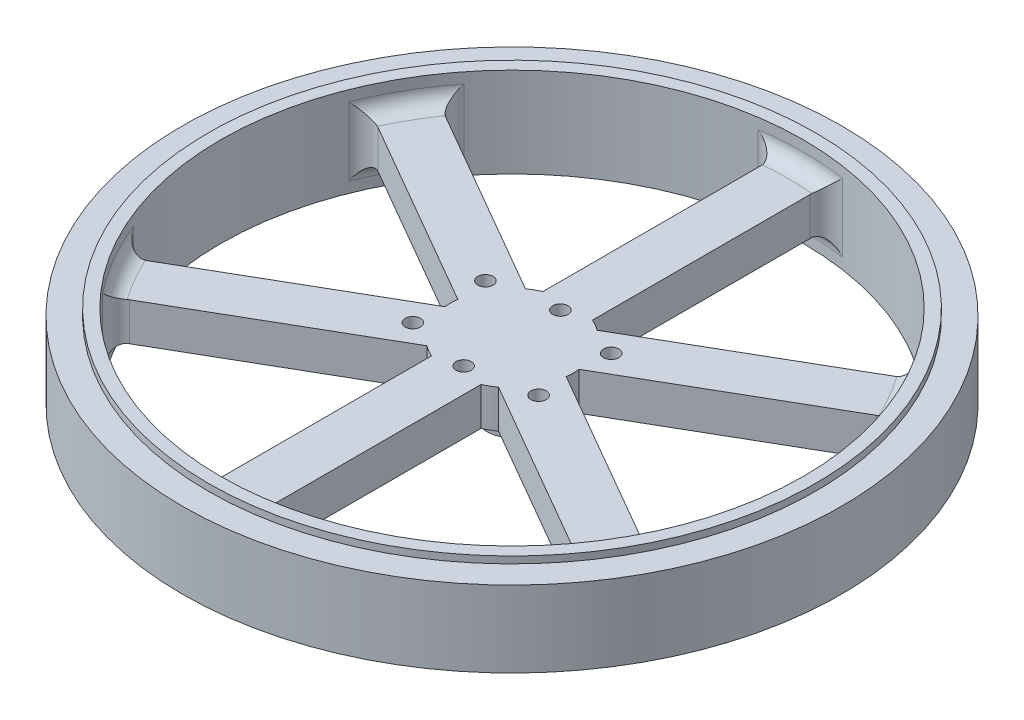
from build123d import *

# Parameters (mm, degrees)
SKETCH1_R                = 43.25
BOSS_EXTRUDE1_DEPTH      = 10
SKETCH3_R                = 39.85
SKETCH3_R_2              = 38.25
BOSS_EXTRUDE2_DEPTH      = 0.9
SKETCH4_R                = 38.25
CUT_EXTRUDE1_DEPTH       = 63.12837516
BOSS_EXTRUDE3_DEPTH      = 2.5
BOSS_EXTRUDE3_DEPTH_BACK = 2.5
SKETCH5_R                = 8
SKETCH6_R                = 3.3
BOSS_EXTRUDE4_DEPTH      = 4
SKETCH7_R                = 1
CUT_EXTRUDE2_DEPTH       = 62.738845146
FILLET1_R                = 2


with BuildPart() as part:
    # Sketch1 → Boss-Extrude1 (new body)
    with BuildSketch(Plane(origin=(0, 0, 0), x_dir=(1, 0, 0), z_dir=(0, 1, 0))):
        with Locations(Location((0, 0, 0), (0, 0, 270))):
            Circle(SKETCH1_R)
    extrude(amount=BOSS_EXTRUDE1_DEPTH)

    # Sketch3 → Boss-Extrude2 (add)
    with BuildSketch(Plane(origin=(0, 10, 0), x_dir=(1, 0, 0), z_dir=(0, 1, 0))):
        with Locations(Location((0, 0, 0), (0, 0, 270))):
            Circle(SKETCH3_R)
        with Locations(Location((0, 0, 0), (0, 0, 270))):
            Circle(SKETCH3_R_2, mode=Mode.SUBTRACT)
    boss_extrude2 = extrude(amount=BOSS_EXTRUDE2_DEPTH)

    # Mirror1: Boss-Extrude2 across plane
    add(boss_extrude2.mirror(Plane.ZX.offset(5)))

    # Sketch4 → Cut-Extrude1 (cut, through all)
    with BuildSketch(Plane(origin=(0, 10, 0), x_dir=(1, 0, 0), z_dir=(0, 1, 0))):
        with Locations(Location((0, 0, 0), (0, 0, 270))):
            Circle(SKETCH4_R)
    extrude(amount=-CUT_EXTRUDE1_DEPTH, mode=Mode.SUBTRACT)

    # Sketch5 → Boss-Extrude3 (add, two sides: drawn at the far end of the back side and taken through both)
    with BuildSketch(Plane(origin=(0, 5, 0), x_dir=(1, 0, 0), z_dir=(0, 1, 0)).offset(-BOSS_EXTRUDE3_DEPTH_BACK)):
        with BuildLine():
            ThreePointArc((-7.955728631, 0.840465317), (-6.92820323, 4), (-4.705728631, 6.469630442))
            Line((-4.705728631, 6.469630442), (-31.380681329, 21.870421562))
            ThreePointArc((-31.380681329, 21.870421562), (-33.125471695, 19.125), (-34.630681329, 16.241256438))
            Line((-34.630681329, 16.241256438), (-7.955728631, 0.840465317))
        make_face()
        with BuildLine():
            Line((0, 38.25), (0, 8))
            ThreePointArc((0, 8), (1.661209489, 7.825623492), (3.25, 7.310095759))
            Line((3.25, 7.310095759), (3.25, 38.111678))
            ThreePointArc((3.25, 38.111678), (1.626471101, 38.215403854), (0, 38.25))
        make_face()
        with BuildLine():
            ThreePointArc((-3.25, 7.310095759), (-1.661209489, 7.825623492), (0, 8))
            Line((0, 8), (0, 38.25))
            ThreePointArc((0, 38.25), (-1.626471101, 38.215403854), (-3.25, 38.111678))
            Line((-3.25, 38.111678), (-3.25, 7.310095759))
        make_face()
        with BuildLine():
            Line((31.380681329, 21.870421562), (4.705728631, 6.469630442))
            ThreePointArc((4.705728631, 6.469630442), (6.92820323, 4), (7.955728631, 0.840465317))
            Line((7.955728631, 0.840465317), (34.630681329, 16.241256438))
            ThreePointArc((34.630681329, 16.241256438), (33.125471695, 19.125), (31.380681329, 21.870421562))
        make_face()
        with BuildLine():
            Line((34.630681329, -16.241256438), (7.955728631, -0.840465317))
            ThreePointArc((7.955728631, -0.840465317), (6.92820323, -4), (4.705728631, -6.469630442))
            Line((4.705728631, -6.469630442), (31.380681329, -21.870421562))
            ThreePointArc((31.380681329, -21.870421562), (33.125471695, -19.125), (34.630681329, -16.241256438))
        make_face()
        with BuildLine():
            ThreePointArc((3.25, -7.310095759), (0, -8), (-3.25, -7.310095759))
            Line((-3.25, -7.310095759), (-3.25, -38.111678))
            ThreePointArc((-3.25, -38.111678), (0, -38.25), (3.25, -38.111678))
            Line((3.25, -38.111678), (3.25, -7.310095759))
        make_face()
        with BuildLine():
            ThreePointArc((-4.705728631, -6.469630442), (-6.92820323, -4), (-7.955728631, -0.840465317))
            Line((-7.955728631, -0.840465317), (-34.630681329, -16.241256438))
            ThreePointArc((-34.630681329, -16.241256438), (-33.125471695, -19.125), (-31.380681329, -21.870421562))
            Line((-31.380681329, -21.870421562), (-4.705728631, -6.469630442))
        make_face()
        Circle(SKETCH5_R)
    extrude(amount=BOSS_EXTRUDE3_DEPTH + BOSS_EXTRUDE3_DEPTH_BACK)

    # Sketch6 → Boss-Extrude4 (add)
    with BuildSketch(Plane(origin=(0, 2.5, 0), x_dir=(-1, 0, 0), z_dir=(0, -1, 0))):
        with Locations(Location((0, 0, 0), (0, 0, 270))):
            Circle(SKETCH6_R)
    extrude(amount=BOSS_EXTRUDE4_DEPTH)

    # Sketch7 → Cut-Extrude2 (cut, through all)
    with BuildSketch(Plane(origin=(0, 2.5, 0), x_dir=(-1, 0, 0), z_dir=(0, -1, 0))):
        with Locations(Location((0, -6.35, 0), (0, 0, 90))):
            Circle(SKETCH7_R)
        with Locations(Location((0, 6.35, 0), (0, 0, 270))):
            Circle(SKETCH7_R)
        with Locations(Location((-8.249757996, -4.763, 0), (0, 0, 90))):
            Circle(SKETCH7_R)
        with Locations(Location((-8.249757996, 4.763, 0), (0, 0, 90))):
            Circle(SKETCH7_R)
        with Locations(Location((8.249757996, 4.763, 0), (0, 0, 90))):
            Circle(SKETCH7_R)
        with Locations(Location((8.249757996, -4.763, 0), (0, 0, 90))):
            Circle(SKETCH7_R)
    extrude(amount=-CUT_EXTRUDE2_DEPTH, mode=Mode.SUBTRACT)

    # Fillet1
    # the kernel refuses this fillet: 2 mm, written as the material it adds along each edge
    with BuildSketch(Plane(origin=(-3.25, 2.5, -38.111678), x_dir=(-0.9933713202979351, 0, 0.1149496411892501), z_dir=(0, 1, 0)), Plane(origin=(31.380681329, 2.5, -21.870421562), x_dir=(-0.5962349695747641, 0, -0.8028099781742754), z_dir=(0, 1, 0)), Plane(origin=(31.380681329, 7.5, 21.870421562), x_dir=(-0.5962349695747706, 0, 0.8028099781742702), z_dir=(0, -1, 0)), Plane(origin=(3.25, 2.5, 38.111678), x_dir=(0.9933713202979246, 0, -0.11494964118934071), z_dir=(0, 1, 0)), Plane(origin=(-31.380681329, 2.5, 21.870421562), x_dir=(0.5962349695747768, 0, 0.8028099781742658), z_dir=(0, 1, 0)), Plane(origin=(-34.630681329, 2.5, -16.241256438), x_dir=(-0.39713635072318026, 0, 0.9177596193635211), z_dir=(0, 1, 0))) as fillet1_piece_1:
        with BuildLine():
            CenterArc((2.244674132, 1.999091986), FILLET1_R, 173.399279561, 98.327295218)
            Line((0.257931492, 2.228991268), (0, 0))
            ThreePointArc((0, 0), (1.15246692, -0.017365772), (2.304933841, 0))
        make_face()
    fillet1_piece_1_solid = extrude(amount=5, mode=Mode.PRIVATE)
    with BuildSketch(Plane(origin=(0, 2.5, 0), x_dir=(0.21411864564449046, 0, -0.9768076604876565), z_dir=(0.9768076604876565, 0, 0.21411864564449046))) as fillet1_piece_2_section:
        with BuildLine():
            CenterArc((38.25 - FILLET1_R, -FILLET1_R), FILLET1_R, 0, 90)
            Line((38.25 - FILLET1_R, 0), (38.25, 0))
            Line((38.25, 0), (38.25, -FILLET1_R))
        make_face()
    fillet1_piece_2 = revolve(axis=Axis((0, 2.5, 0), (0, 1, 0)), revolution_arc=24.727650657, mode=Mode.PRIVATE)
    fillet1_piece_2 = split(fillet1_piece_2, bisect_by=Plane(origin=(3.25, 2.5, 0), z_dir=(-1, 0, 0)), keep=Keep.TOP, mode=Mode.PRIVATE)
    fillet1_piece_2 = split(fillet1_piece_2, bisect_by=Plane(origin=(-3.25, 2.5, 0), z_dir=(1, 0, 0)), keep=Keep.TOP, mode=Mode.PRIVATE)
    with BuildSketch(Plane(origin=(3.25, 2.5, -38.111678), x_dir=(0.9933713202979347, 0, 0.11494964118925292), z_dir=(0, 1, 0)), Plane(origin=(34.630681329, 2.5, -16.241256438), x_dir=(0.39713635072316383, 0, 0.9177596193635281), z_dir=(0, 1, 0)), Plane(origin=(34.630681329, 7.5, 16.241256438), x_dir=(0.39713635072317044, 0, -0.9177596193635253), z_dir=(0, -1, 0)), Plane(origin=(-3.25, 2.5, 38.111678), x_dir=(-0.9933713202979313, 0, -0.11494964118928287), z_dir=(0, 1, 0)), Plane(origin=(-34.630681329, 2.5, 16.241256438), x_dir=(-0.3971363507232063, 0, -0.9177596193635098), z_dir=(0, 1, 0)), Plane(origin=(-31.380681329, 2.5, -21.870421562), x_dir=(0.5962349695747751, 0, -0.802809978174267), z_dir=(0, 1, 0))) as fillet1_piece_3:
        with BuildLine():
            CenterArc((2.244674132, -1.999091986), FILLET1_R, 88.273425221, 98.327295218)
            Line((0.257931492, -2.228991268), (0, 0))
            ThreePointArc((0, 0), (1.15246692, 0.017365772), (2.304933841, 0))
        make_face()
    fillet1_piece_3_solid = extrude(amount=5, mode=Mode.PRIVATE)
    with BuildSketch(Plane(origin=(0, 2.5, 0), x_dir=(0.9529995714158058, 0, -0.3029716436917663), z_dir=(0.3029716436917663, 0, 0.9529995714158058))) as fillet1_piece_4_section:
        with BuildLine():
            CenterArc((38.25 - FILLET1_R, -FILLET1_R), FILLET1_R, 0, 90)
            Line((38.25 - FILLET1_R, 0), (38.25, 0))
            Line((38.25, 0), (38.25, -FILLET1_R))
        make_face()
    fillet1_piece_4 = revolve(axis=Axis((0, 2.5, 0), (0, 1, 0)), revolution_arc=24.727650657, mode=Mode.PRIVATE)
    fillet1_piece_4 = split(fillet1_piece_4, bisect_by=Plane(origin=(1.625, 2.5, 2.814582562), z_dir=(-0.49999999999999806, 0, -0.8660254037844398)), keep=Keep.TOP, mode=Mode.PRIVATE)
    fillet1_piece_4 = split(fillet1_piece_4, bisect_by=Plane(origin=(-1.625, 2.5, -2.814582562), z_dir=(0.49999999999999806, 0, 0.8660254037844398)), keep=Keep.TOP, mode=Mode.PRIVATE)
    with BuildSketch(Plane(origin=(0, 2.5, 0), x_dir=(0.738880925771294, 0, 0.6738360167958934), z_dir=(-0.6738360167958934, 0, 0.738880925771294))) as fillet1_piece_5_section:
        with BuildLine():
            CenterArc((38.25 - FILLET1_R, -FILLET1_R), FILLET1_R, 0, 90)
            Line((38.25 - FILLET1_R, 0), (38.25, 0))
            Line((38.25, 0), (38.25, -FILLET1_R))
        make_face()
    fillet1_piece_5 = revolve(axis=Axis((0, 2.5, 0), (0, 1, 0)), revolution_arc=24.727650657, mode=Mode.PRIVATE)
    fillet1_piece_5 = split(fillet1_piece_5, bisect_by=Plane(origin=(1.625, 2.5, -2.814582562), z_dir=(-0.500000000000004, 0, 0.8660254037844364)), keep=Keep.TOP, mode=Mode.PRIVATE)
    fillet1_piece_5 = split(fillet1_piece_5, bisect_by=Plane(origin=(-1.625, 2.5, 2.814582562), z_dir=(0.500000000000004, 0, -0.8660254037844364)), keep=Keep.TOP, mode=Mode.PRIVATE)
    with BuildSketch(Plane(origin=(0, 2.5, 0), x_dir=(-0.2141181944422645, 0, 0.976807759392187), z_dir=(-0.976807759392187, 0, -0.2141181944422645))) as fillet1_piece_6_section:
        with BuildLine():
            CenterArc((38.25 - FILLET1_R, -FILLET1_R), FILLET1_R, 0, 90)
            Line((38.25 - FILLET1_R, 0), (38.25, 0))
            Line((38.25, 0), (38.25, -FILLET1_R))
        make_face()
    fillet1_piece_6 = revolve(axis=Axis((0, 2.5, 0), (0, 1, 0)), revolution_arc=12.363798863, mode=Mode.PRIVATE)
    fillet1_piece_6 = split(fillet1_piece_6, bisect_by=Plane(origin=(-3.25, 2.5, 0), z_dir=(1, 0, 0)), keep=Keep.TOP, mode=Mode.PRIVATE)
    with BuildSketch(Plane(origin=(0, 2.5, 0), x_dir=(-0.952999571415801, 0, 0.30297164369178087), z_dir=(-0.30297164369178087, 0, -0.952999571415801))) as fillet1_piece_7_section:
        with BuildLine():
            CenterArc((38.25 - FILLET1_R, -FILLET1_R), FILLET1_R, 0, 90)
            Line((38.25 - FILLET1_R, 0), (38.25, 0))
            Line((38.25, 0), (38.25, -FILLET1_R))
        make_face()
    fillet1_piece_7 = revolve(axis=Axis((0, 2.5, 0), (0, 1, 0)), revolution_arc=24.727650657, mode=Mode.PRIVATE)
    fillet1_piece_7 = split(fillet1_piece_7, bisect_by=Plane(origin=(1.625, 2.5, 2.814582562), z_dir=(-0.500000000000019, 0, -0.8660254037844277)), keep=Keep.TOP, mode=Mode.PRIVATE)
    fillet1_piece_7 = split(fillet1_piece_7, bisect_by=Plane(origin=(-1.625, 2.5, -2.814582562), z_dir=(0.5000000000000189, 0, 0.8660254037844278)), keep=Keep.TOP, mode=Mode.PRIVATE)
    with BuildSketch(Plane(origin=(0, 2.5, 0), x_dir=(-0.7388809257712972, 0, -0.6738360167958901), z_dir=(0.6738360167958901, 0, -0.7388809257712972))) as fillet1_piece_8_section:
        with BuildLine():
            CenterArc((38.25 - FILLET1_R, -FILLET1_R), FILLET1_R, 0, 90)
            Line((38.25 - FILLET1_R, 0), (38.25, 0))
            Line((38.25, 0), (38.25, -FILLET1_R))
        make_face()
    fillet1_piece_8 = revolve(axis=Axis((0, 2.5, 0), (0, 1, 0)), revolution_arc=24.727650657, mode=Mode.PRIVATE)
    fillet1_piece_8 = split(fillet1_piece_8, bisect_by=Plane(origin=(1.625, 2.5, -2.814582562), z_dir=(-0.5000000000000101, 0, 0.8660254037844328)), keep=Keep.TOP, mode=Mode.PRIVATE)
    fillet1_piece_8 = split(fillet1_piece_8, bisect_by=Plane(origin=(-1.625, 2.5, 2.814582562), z_dir=(0.5000000000000099, 0, -0.8660254037844329)), keep=Keep.TOP, mode=Mode.PRIVATE)
    with BuildSketch(Plane(origin=(0, 7.5, 0), x_dir=(-0.21411864564449054, 0, -0.9768076604876568), z_dir=(-0.9768076604876568, 0, 0.21411864564449054))) as fillet1_piece_9_section:
        with BuildLine():
            CenterArc((38.25 - FILLET1_R, -FILLET1_R), FILLET1_R, 0, 90)
            Line((38.25 - FILLET1_R, 0), (38.25, 0))
            Line((38.25, 0), (38.25, -FILLET1_R))
        make_face()
    fillet1_piece_9 = revolve(axis=Axis((0, 7.5, 0), (0, -1, 0)), revolution_arc=24.727650657, mode=Mode.PRIVATE)
    fillet1_piece_9 = split(fillet1_piece_9, bisect_by=Plane(origin=(3.25, 7.5, 0), z_dir=(-1, 0, 0)), keep=Keep.TOP, mode=Mode.PRIVATE)
    fillet1_piece_9 = split(fillet1_piece_9, bisect_by=Plane(origin=(-3.25, 7.5, 0), z_dir=(1, 0, 0)), keep=Keep.TOP, mode=Mode.PRIVATE)
    with BuildSketch(Plane(origin=(0, 7.5, 0), x_dir=(-0.7388809257712972, 0, -0.6738360167958901), z_dir=(0.6738360167958901, 0, -0.7388809257712972))) as fillet1_piece_10_section:
        with BuildLine():
            CenterArc((38.25 - FILLET1_R, FILLET1_R), FILLET1_R, 270, 90)
            Line((38.25 - FILLET1_R, 0), (38.25, 0))
            Line((38.25, 0), (38.25, FILLET1_R))
        make_face()
    fillet1_piece_10 = revolve(axis=Axis((0, 7.5, 0), (0, 1, 0)), revolution_arc=24.727650657, mode=Mode.PRIVATE)
    fillet1_piece_10 = split(fillet1_piece_10, bisect_by=Plane(origin=(1.625, 7.5, -2.814582562), z_dir=(-0.5000000000000101, 0, 0.8660254037844328)), keep=Keep.TOP, mode=Mode.PRIVATE)
    fillet1_piece_10 = split(fillet1_piece_10, bisect_by=Plane(origin=(-1.625, 7.5, 2.814582562), z_dir=(0.5000000000000099, 0, -0.8660254037844329)), keep=Keep.TOP, mode=Mode.PRIVATE)
    with BuildSketch(Plane(origin=(0, 7.5, 0), x_dir=(-0.952999571415801, 0, 0.30297164369178087), z_dir=(-0.30297164369178087, 0, -0.952999571415801))) as fillet1_piece_11_section:
        with BuildLine():
            CenterArc((38.25 - FILLET1_R, FILLET1_R), FILLET1_R, 270, 90)
            Line((38.25 - FILLET1_R, 0), (38.25, 0))
            Line((38.25, 0), (38.25, FILLET1_R))
        make_face()
    fillet1_piece_11 = revolve(axis=Axis((0, 7.5, 0), (0, 1, 0)), revolution_arc=24.727650657, mode=Mode.PRIVATE)
    fillet1_piece_11 = split(fillet1_piece_11, bisect_by=Plane(origin=(1.625, 7.5, 2.814582562), z_dir=(-0.500000000000019, 0, -0.8660254037844277)), keep=Keep.TOP, mode=Mode.PRIVATE)
    fillet1_piece_11 = split(fillet1_piece_11, bisect_by=Plane(origin=(-1.625, 7.5, -2.814582562), z_dir=(0.5000000000000189, 0, 0.8660254037844278)), keep=Keep.TOP, mode=Mode.PRIVATE)
    with BuildSketch(Plane(origin=(0, 7.5, 0), x_dir=(-0.2141181944422645, 0, 0.976807759392187), z_dir=(-0.976807759392187, 0, -0.2141181944422645))) as fillet1_piece_12_section:
        with BuildLine():
            CenterArc((38.25 - FILLET1_R, FILLET1_R), FILLET1_R, 270, 90)
            Line((38.25 - FILLET1_R, 0), (38.25, 0))
            Line((38.25, 0), (38.25, FILLET1_R))
        make_face()
    fillet1_piece_12 = revolve(axis=Axis((0, 7.5, 0), (0, 1, 0)), revolution_arc=12.363798863, mode=Mode.PRIVATE)
    fillet1_piece_12 = split(fillet1_piece_12, bisect_by=Plane(origin=(-3.25, 7.5, 0), z_dir=(1, 0, 0)), keep=Keep.TOP, mode=Mode.PRIVATE)
    with BuildSketch(Plane(origin=(0, 7.5, 0), x_dir=(0.738880925771294, 0, 0.6738360167958934), z_dir=(-0.6738360167958934, 0, 0.738880925771294))) as fillet1_piece_13_section:
        with BuildLine():
            CenterArc((38.25 - FILLET1_R, FILLET1_R), FILLET1_R, 270, 90)
            Line((38.25 - FILLET1_R, 0), (38.25, 0))
            Line((38.25, 0), (38.25, FILLET1_R))
        make_face()
    fillet1_piece_13 = revolve(axis=Axis((0, 7.5, 0), (0, 1, 0)), revolution_arc=24.727650657, mode=Mode.PRIVATE)
    fillet1_piece_13 = split(fillet1_piece_13, bisect_by=Plane(origin=(1.625, 7.5, -2.814582562), z_dir=(-0.500000000000004, 0, 0.8660254037844364)), keep=Keep.TOP, mode=Mode.PRIVATE)
    fillet1_piece_13 = split(fillet1_piece_13, bisect_by=Plane(origin=(-1.625, 7.5, 2.814582562), z_dir=(0.500000000000004, 0, -0.8660254037844364)), keep=Keep.TOP, mode=Mode.PRIVATE)
    with BuildSketch(Plane(origin=(0, 7.5, 0), x_dir=(0.9529995714158058, 0, -0.3029716436917663), z_dir=(0.3029716436917663, 0, 0.9529995714158058))) as fillet1_piece_14_section:
        with BuildLine():
            CenterArc((38.25 - FILLET1_R, FILLET1_R), FILLET1_R, 270, 90)
            Line((38.25 - FILLET1_R, 0), (38.25, 0))
            Line((38.25, 0), (38.25, FILLET1_R))
        make_face()
    fillet1_piece_14 = revolve(axis=Axis((0, 7.5, 0), (0, 1, 0)), revolution_arc=24.727650657, mode=Mode.PRIVATE)
    fillet1_piece_14 = split(fillet1_piece_14, bisect_by=Plane(origin=(1.625, 7.5, 2.814582562), z_dir=(-0.49999999999999806, 0, -0.8660254037844398)), keep=Keep.TOP, mode=Mode.PRIVATE)
    fillet1_piece_14 = split(fillet1_piece_14, bisect_by=Plane(origin=(-1.625, 7.5, -2.814582562), z_dir=(0.49999999999999806, 0, 0.8660254037844398)), keep=Keep.TOP, mode=Mode.PRIVATE)
    with BuildSketch(Plane(origin=(0, 7.5, 0), x_dir=(0, 0, 1), z_dir=(-1, 0, 0))) as fillet1_piece_15_section:
        with BuildLine():
            CenterArc((38.25 - FILLET1_R, FILLET1_R), FILLET1_R, 270, 90)
            Line((38.25 - FILLET1_R, 0), (38.25, 0))
            Line((38.25, 0), (38.25, FILLET1_R))
        make_face()
    fillet1_piece_15 = revolve(axis=Axis((0, 7.5, 0), (0, 1, 0)), revolution_arc=12.363798863, mode=Mode.PRIVATE)
    fillet1_piece_15 = split(fillet1_piece_15, bisect_by=Plane(origin=(3.25, 7.5, 0), z_dir=(-1, 0, 0)), keep=Keep.TOP, mode=Mode.PRIVATE)
    with BuildSketch(Plane(origin=(0, 2.5, 0), x_dir=(0, 0, 1), z_dir=(-1, 0, 0))) as fillet1_piece_16_section:
        with BuildLine():
            CenterArc((38.25 - FILLET1_R, -FILLET1_R), FILLET1_R, 0, 90)
            Line((38.25 - FILLET1_R, 0), (38.25, 0))
            Line((38.25, 0), (38.25, -FILLET1_R))
        make_face()
    fillet1_piece_16 = revolve(axis=Axis((0, 2.5, 0), (0, 1, 0)), revolution_arc=12.363798863, mode=Mode.PRIVATE)
    fillet1_piece_16 = split(fillet1_piece_16, bisect_by=Plane(origin=(3.25, 2.5, 0), z_dir=(-1, 0, 0)), keep=Keep.TOP, mode=Mode.PRIVATE)
    with BuildSketch(Plane(origin=(0, 2.5, 0), x_dir=(0.21411864564449046, 0, -0.9768076604876565), z_dir=(0.9768076604876565, 0, 0.21411864564449046))) as fillet1_piece_17a_section:
        with BuildLine():
            CenterArc((38.25 - FILLET1_R, -FILLET1_R), FILLET1_R, 0, 90)
            Line((38.25 - FILLET1_R, 0), (38.25, 0))
            Line((38.25, 0), (38.25, -FILLET1_R))
        make_face()
    fillet1_piece_17a = revolve(axis=Axis((0, 2.5, 0), (0, 1, 0)), revolution_arc=24.727650657, mode=Mode.PRIVATE)
    fillet1_piece_17a = split(fillet1_piece_17a, bisect_by=Plane(origin=(-3.25, 2.5, 0), z_dir=(-1, 0, 0)), keep=Keep.TOP, mode=Mode.PRIVATE)
    with BuildSketch(Plane(origin=(-3.25, -3.262334601, -38.111678), x_dir=(-0.9933713202979351, 0, 0.1149496411892501), z_dir=(0, 1, 0))) as fillet1_piece_17b_section:
        with BuildLine():
            CenterArc((2.244674132, 1.999091986), FILLET1_R, 173.399279561, 98.327295218)
            Line((0.257931492, 2.228991268), (0, 0))
            ThreePointArc((0, 0), (1.15246692, -0.017365772), (2.304933841, 0))
        make_face()
    fillet1_piece_17b = extrude(amount=10.762334601, mode=Mode.PRIVATE)
    fillet1_piece_17b = split(fillet1_piece_17b, bisect_by=Plane(origin=(-3.25, -0.9, -38.111678), z_dir=(0, 1, 0)), keep=Keep.TOP, mode=Mode.PRIVATE)
    fillet1_piece_17b = split(fillet1_piece_17b, bisect_by=Plane(origin=(-3.25, 2.5, -38.111678), z_dir=(0, -1, 0)), keep=Keep.TOP, mode=Mode.PRIVATE)
    fillet1_piece_17 = fillet1_piece_17a & fillet1_piece_17b
    with BuildSketch(Plane(origin=(-3.25, 2.5, -38.111678), x_dir=(-0.9933713202979351, 0, 0.1149496411892501), z_dir=(0, 1, 0))) as fillet1_piece_18a_section:
        with BuildLine():
            CenterArc((2.244674132, 1.999091986), FILLET1_R, 173.399279561, 98.327295218)
            Line((0.257931492, 2.228991268), (0, 0))
            ThreePointArc((0, 0), (1.15246692, -0.017365772), (2.304933841, 0))
        make_face()
    fillet1_piece_18a = extrude(amount=10.762334601, mode=Mode.PRIVATE)
    fillet1_piece_18a = split(fillet1_piece_18a, bisect_by=Plane(origin=(-3.25, 10.9, -38.111678), z_dir=(0, -1, 0)), keep=Keep.TOP, mode=Mode.PRIVATE)
    fillet1_piece_18a = split(fillet1_piece_18a, bisect_by=Plane(origin=(-3.25, 7.5, -38.111678), z_dir=(0, 1, 0)), keep=Keep.TOP, mode=Mode.PRIVATE)
    with BuildSketch(Plane(origin=(0, 7.5, 0), x_dir=(-0.21411864564449054, 0, -0.9768076604876568), z_dir=(-0.9768076604876568, 0, 0.21411864564449054))) as fillet1_piece_18b_section:
        with BuildLine():
            CenterArc((38.25 - FILLET1_R, -FILLET1_R), FILLET1_R, 0, 90)
            Line((38.25 - FILLET1_R, 0), (38.25, 0))
            Line((38.25, 0), (38.25, -FILLET1_R))
        make_face()
    fillet1_piece_18b = revolve(axis=Axis((0, 7.5, 0), (0, -1, 0)), revolution_arc=24.727650657, mode=Mode.PRIVATE)
    fillet1_piece_18b = split(fillet1_piece_18b, bisect_by=Plane(origin=(-3.25, 7.5, 0), z_dir=(-1, 0, 0)), keep=Keep.TOP, mode=Mode.PRIVATE)
    fillet1_piece_18 = fillet1_piece_18a & fillet1_piece_18b
    with BuildSketch(Plane(origin=(0, 2.5, 0), x_dir=(0.21411864564449046, 0, -0.9768076604876565), z_dir=(0.9768076604876565, 0, 0.21411864564449046))) as fillet1_piece_19a_section:
        with BuildLine():
            CenterArc((38.25 - FILLET1_R, -FILLET1_R), FILLET1_R, 0, 90)
            Line((38.25 - FILLET1_R, 0), (38.25, 0))
            Line((38.25, 0), (38.25, -FILLET1_R))
        make_face()
    fillet1_piece_19a = revolve(axis=Axis((0, 2.5, 0), (0, 1, 0)), revolution_arc=24.727650657, mode=Mode.PRIVATE)
    fillet1_piece_19a = split(fillet1_piece_19a, bisect_by=Plane(origin=(3.25, 2.5, 0), z_dir=(1, 0, 0)), keep=Keep.TOP, mode=Mode.PRIVATE)
    with BuildSketch(Plane(origin=(3.25, -3.262334601, -38.111678), x_dir=(0.9933713202979347, 0, 0.11494964118925292), z_dir=(0, 1, 0))) as fillet1_piece_19b_section:
        with BuildLine():
            CenterArc((2.244674132, -1.999091986), FILLET1_R, 88.273425221, 98.327295218)
            Line((0.257931492, -2.228991268), (0, 0))
            ThreePointArc((0, 0), (1.15246692, 0.017365772), (2.304933841, 0))
        make_face()
    fillet1_piece_19b = extrude(amount=10.762334601, mode=Mode.PRIVATE)
    fillet1_piece_19b = split(fillet1_piece_19b, bisect_by=Plane(origin=(3.25, -0.9, -38.111678), z_dir=(0, 1, 0)), keep=Keep.TOP, mode=Mode.PRIVATE)
    fillet1_piece_19b = split(fillet1_piece_19b, bisect_by=Plane(origin=(3.25, 2.5, -38.111678), z_dir=(0, -1, 0)), keep=Keep.TOP, mode=Mode.PRIVATE)
    fillet1_piece_19 = fillet1_piece_19a & fillet1_piece_19b
    with BuildSketch(Plane(origin=(0, 7.5, 0), x_dir=(-0.21411864564449054, 0, -0.9768076604876568), z_dir=(-0.9768076604876568, 0, 0.21411864564449054))) as fillet1_piece_20a_section:
        with BuildLine():
            CenterArc((38.25 - FILLET1_R, -FILLET1_R), FILLET1_R, 0, 90)
            Line((38.25 - FILLET1_R, 0), (38.25, 0))
            Line((38.25, 0), (38.25, -FILLET1_R))
        make_face()
    fillet1_piece_20a = revolve(axis=Axis((0, 7.5, 0), (0, -1, 0)), revolution_arc=24.727650657, mode=Mode.PRIVATE)
    fillet1_piece_20a = split(fillet1_piece_20a, bisect_by=Plane(origin=(3.25, 7.5, 0), z_dir=(1, 0, 0)), keep=Keep.TOP, mode=Mode.PRIVATE)
    with BuildSketch(Plane(origin=(3.25, 2.5, -38.111678), x_dir=(0.9933713202979347, 0, 0.11494964118925292), z_dir=(0, 1, 0))) as fillet1_piece_20b_section:
        with BuildLine():
            CenterArc((2.244674132, -1.999091986), FILLET1_R, 88.273425221, 98.327295218)
            Line((0.257931492, -2.228991268), (0, 0))
            ThreePointArc((0, 0), (1.15246692, 0.017365772), (2.304933841, 0))
        make_face()
    fillet1_piece_20b = extrude(amount=10.762334601, mode=Mode.PRIVATE)
    fillet1_piece_20b = split(fillet1_piece_20b, bisect_by=Plane(origin=(3.25, 10.9, -38.111678), z_dir=(0, -1, 0)), keep=Keep.TOP, mode=Mode.PRIVATE)
    fillet1_piece_20b = split(fillet1_piece_20b, bisect_by=Plane(origin=(3.25, 7.5, -38.111678), z_dir=(0, 1, 0)), keep=Keep.TOP, mode=Mode.PRIVATE)
    fillet1_piece_20 = fillet1_piece_20a & fillet1_piece_20b
    with BuildSketch(Plane(origin=(0, 2.5, 0), x_dir=(0.9529995714158058, 0, -0.3029716436917663), z_dir=(0.3029716436917663, 0, 0.9529995714158058))) as fillet1_piece_21a_section:
        with BuildLine():
            CenterArc((38.25 - FILLET1_R, -FILLET1_R), FILLET1_R, 0, 90)
            Line((38.25 - FILLET1_R, 0), (38.25, 0))
            Line((38.25, 0), (38.25, -FILLET1_R))
        make_face()
    fillet1_piece_21a = revolve(axis=Axis((0, 2.5, 0), (0, 1, 0)), revolution_arc=24.727650657, mode=Mode.PRIVATE)
    fillet1_piece_21a = split(fillet1_piece_21a, bisect_by=Plane(origin=(-1.625, 2.5, -2.814582562), z_dir=(-0.49999999999999806, 0, -0.8660254037844398)), keep=Keep.TOP, mode=Mode.PRIVATE)
    with BuildSketch(Plane(origin=(31.380681329, -3.262334601, -21.870421562), x_dir=(-0.5962349695747641, 0, -0.8028099781742754), z_dir=(0, 1, 0))) as fillet1_piece_21b_section:
        with BuildLine():
            CenterArc((2.244674132, 1.999091986), FILLET1_R, 173.399279561, 98.327295218)
            Line((0.257931492, 2.228991268), (0, 0))
            ThreePointArc((0, 0), (1.15246692, -0.017365772), (2.304933841, 0))
        make_face()
    fillet1_piece_21b = extrude(amount=10.762334601, mode=Mode.PRIVATE)
    fillet1_piece_21b = split(fillet1_piece_21b, bisect_by=Plane(origin=(31.380681329, -0.9, -21.870421562), z_dir=(0, 1, 0)), keep=Keep.TOP, mode=Mode.PRIVATE)
    fillet1_piece_21b = split(fillet1_piece_21b, bisect_by=Plane(origin=(31.380681329, 2.5, -21.870421562), z_dir=(0, -1, 0)), keep=Keep.TOP, mode=Mode.PRIVATE)
    fillet1_piece_21 = fillet1_piece_21a & fillet1_piece_21b
    with BuildSketch(Plane(origin=(31.380681329, 2.5, -21.870421562), x_dir=(-0.5962349695747641, 0, -0.8028099781742754), z_dir=(0, 1, 0))) as fillet1_piece_22a_section:
        with BuildLine():
            CenterArc((2.244674132, 1.999091986), FILLET1_R, 173.399279561, 98.327295218)
            Line((0.257931492, 2.228991268), (0, 0))
            ThreePointArc((0, 0), (1.15246692, -0.017365772), (2.304933841, 0))
        make_face()
    fillet1_piece_22a = extrude(amount=10.762334601, mode=Mode.PRIVATE)
    fillet1_piece_22a = split(fillet1_piece_22a, bisect_by=Plane(origin=(31.380681329, 10.9, -21.870421562), z_dir=(0, -1, 0)), keep=Keep.TOP, mode=Mode.PRIVATE)
    fillet1_piece_22a = split(fillet1_piece_22a, bisect_by=Plane(origin=(31.380681329, 7.5, -21.870421562), z_dir=(0, 1, 0)), keep=Keep.TOP, mode=Mode.PRIVATE)
    with BuildSketch(Plane(origin=(0, 7.5, 0), x_dir=(0.9529995714158058, 0, -0.3029716436917663), z_dir=(0.3029716436917663, 0, 0.9529995714158058))) as fillet1_piece_22b_section:
        with BuildLine():
            CenterArc((38.25 - FILLET1_R, FILLET1_R), FILLET1_R, 270, 90)
            Line((38.25 - FILLET1_R, 0), (38.25, 0))
            Line((38.25, 0), (38.25, FILLET1_R))
        make_face()
    fillet1_piece_22b = revolve(axis=Axis((0, 7.5, 0), (0, 1, 0)), revolution_arc=24.727650657, mode=Mode.PRIVATE)
    fillet1_piece_22b = split(fillet1_piece_22b, bisect_by=Plane(origin=(-1.625, 7.5, -2.814582562), z_dir=(-0.49999999999999806, 0, -0.8660254037844398)), keep=Keep.TOP, mode=Mode.PRIVATE)
    fillet1_piece_22 = fillet1_piece_22a & fillet1_piece_22b
    with BuildSketch(Plane(origin=(0, 2.5, 0), x_dir=(0.9529995714158058, 0, -0.3029716436917663), z_dir=(0.3029716436917663, 0, 0.9529995714158058))) as fillet1_piece_23a_section:
        with BuildLine():
            CenterArc((38.25 - FILLET1_R, -FILLET1_R), FILLET1_R, 0, 90)
            Line((38.25 - FILLET1_R, 0), (38.25, 0))
            Line((38.25, 0), (38.25, -FILLET1_R))
        make_face()
    fillet1_piece_23a = revolve(axis=Axis((0, 2.5, 0), (0, 1, 0)), revolution_arc=24.727650657, mode=Mode.PRIVATE)
    fillet1_piece_23a = split(fillet1_piece_23a, bisect_by=Plane(origin=(1.625, 2.5, 2.814582562), z_dir=(0.49999999999999806, 0, 0.8660254037844398)), keep=Keep.TOP, mode=Mode.PRIVATE)
    with BuildSketch(Plane(origin=(34.630681329, -3.262334601, -16.241256438), x_dir=(0.39713635072316383, 0, 0.9177596193635281), z_dir=(0, 1, 0))) as fillet1_piece_23b_section:
        with BuildLine():
            CenterArc((2.244674132, -1.999091986), FILLET1_R, 88.273425221, 98.327295218)
            Line((0.257931492, -2.228991268), (0, 0))
            ThreePointArc((0, 0), (1.15246692, 0.017365772), (2.304933841, 0))
        make_face()
    fillet1_piece_23b = extrude(amount=10.762334601, mode=Mode.PRIVATE)
    fillet1_piece_23b = split(fillet1_piece_23b, bisect_by=Plane(origin=(34.630681329, -0.9, -16.241256438), z_dir=(0, 1, 0)), keep=Keep.TOP, mode=Mode.PRIVATE)
    fillet1_piece_23b = split(fillet1_piece_23b, bisect_by=Plane(origin=(34.630681329, 2.5, -16.241256438), z_dir=(0, -1, 0)), keep=Keep.TOP, mode=Mode.PRIVATE)
    fillet1_piece_23 = fillet1_piece_23a & fillet1_piece_23b
    with BuildSketch(Plane(origin=(0, 7.5, 0), x_dir=(0.9529995714158058, 0, -0.3029716436917663), z_dir=(0.3029716436917663, 0, 0.9529995714158058))) as fillet1_piece_24a_section:
        with BuildLine():
            CenterArc((38.25 - FILLET1_R, FILLET1_R), FILLET1_R, 270, 90)
            Line((38.25 - FILLET1_R, 0), (38.25, 0))
            Line((38.25, 0), (38.25, FILLET1_R))
        make_face()
    fillet1_piece_24a = revolve(axis=Axis((0, 7.5, 0), (0, 1, 0)), revolution_arc=24.727650657, mode=Mode.PRIVATE)
    fillet1_piece_24a = split(fillet1_piece_24a, bisect_by=Plane(origin=(1.625, 7.5, 2.814582562), z_dir=(0.49999999999999806, 0, 0.8660254037844398)), keep=Keep.TOP, mode=Mode.PRIVATE)
    with BuildSketch(Plane(origin=(34.630681329, 2.5, -16.241256438), x_dir=(0.39713635072316383, 0, 0.9177596193635281), z_dir=(0, 1, 0))) as fillet1_piece_24b_section:
        with BuildLine():
            CenterArc((2.244674132, -1.999091986), FILLET1_R, 88.273425221, 98.327295218)
            Line((0.257931492, -2.228991268), (0, 0))
            ThreePointArc((0, 0), (1.15246692, 0.017365772), (2.304933841, 0))
        make_face()
    fillet1_piece_24b = extrude(amount=10.762334601, mode=Mode.PRIVATE)
    fillet1_piece_24b = split(fillet1_piece_24b, bisect_by=Plane(origin=(34.630681329, 10.9, -16.241256438), z_dir=(0, -1, 0)), keep=Keep.TOP, mode=Mode.PRIVATE)
    fillet1_piece_24b = split(fillet1_piece_24b, bisect_by=Plane(origin=(34.630681329, 7.5, -16.241256438), z_dir=(0, 1, 0)), keep=Keep.TOP, mode=Mode.PRIVATE)
    fillet1_piece_24 = fillet1_piece_24a & fillet1_piece_24b
    with BuildSketch(Plane(origin=(34.630681329, 13.262334601, 16.241256438), x_dir=(0.39713635072317044, 0, -0.9177596193635253), z_dir=(0, -1, 0))) as fillet1_piece_25a_section:
        with BuildLine():
            CenterArc((2.244674132, -1.999091986), FILLET1_R, 88.273425221, 98.327295218)
            Line((0.257931492, -2.228991268), (0, 0))
            ThreePointArc((0, 0), (1.15246692, 0.017365772), (2.304933841, 0))
        make_face()
    fillet1_piece_25a = extrude(amount=10.762334601, mode=Mode.PRIVATE)
    fillet1_piece_25a = split(fillet1_piece_25a, bisect_by=Plane(origin=(34.630681329, 10.9, 16.241256438), z_dir=(0, -1, 0)), keep=Keep.TOP, mode=Mode.PRIVATE)
    fillet1_piece_25a = split(fillet1_piece_25a, bisect_by=Plane(origin=(34.630681329, 7.5, 16.241256438), z_dir=(0, 1, 0)), keep=Keep.TOP, mode=Mode.PRIVATE)
    with BuildSketch(Plane(origin=(0, 7.5, 0), x_dir=(0.738880925771294, 0, 0.6738360167958934), z_dir=(-0.6738360167958934, 0, 0.738880925771294))) as fillet1_piece_25b_section:
        with BuildLine():
            CenterArc((38.25 - FILLET1_R, FILLET1_R), FILLET1_R, 270, 90)
            Line((38.25 - FILLET1_R, 0), (38.25, 0))
            Line((38.25, 0), (38.25, FILLET1_R))
        make_face()
    fillet1_piece_25b = revolve(axis=Axis((0, 7.5, 0), (0, 1, 0)), revolution_arc=24.727650657, mode=Mode.PRIVATE)
    fillet1_piece_25b = split(fillet1_piece_25b, bisect_by=Plane(origin=(1.625, 7.5, -2.814582562), z_dir=(0.500000000000004, 0, -0.8660254037844364)), keep=Keep.TOP, mode=Mode.PRIVATE)
    fillet1_piece_25 = fillet1_piece_25a & fillet1_piece_25b
    with BuildSketch(Plane(origin=(0, 2.5, 0), x_dir=(0.738880925771294, 0, 0.6738360167958934), z_dir=(-0.6738360167958934, 0, 0.738880925771294))) as fillet1_piece_26a_section:
        with BuildLine():
            CenterArc((38.25 - FILLET1_R, -FILLET1_R), FILLET1_R, 0, 90)
            Line((38.25 - FILLET1_R, 0), (38.25, 0))
            Line((38.25, 0), (38.25, -FILLET1_R))
        make_face()
    fillet1_piece_26a = revolve(axis=Axis((0, 2.5, 0), (0, 1, 0)), revolution_arc=24.727650657, mode=Mode.PRIVATE)
    fillet1_piece_26a = split(fillet1_piece_26a, bisect_by=Plane(origin=(1.625, 2.5, -2.814582562), z_dir=(0.500000000000004, 0, -0.8660254037844364)), keep=Keep.TOP, mode=Mode.PRIVATE)
    with BuildSketch(Plane(origin=(34.630681329, 7.5, 16.241256438), x_dir=(0.39713635072317044, 0, -0.9177596193635253), z_dir=(0, -1, 0))) as fillet1_piece_26b_section:
        with BuildLine():
            CenterArc((2.244674132, -1.999091986), FILLET1_R, 88.273425221, 98.327295218)
            Line((0.257931492, -2.228991268), (0, 0))
            ThreePointArc((0, 0), (1.15246692, 0.017365772), (2.304933841, 0))
        make_face()
    fillet1_piece_26b = extrude(amount=10.762334601, mode=Mode.PRIVATE)
    fillet1_piece_26b = split(fillet1_piece_26b, bisect_by=Plane(origin=(34.630681329, -0.9, 16.241256438), z_dir=(0, 1, 0)), keep=Keep.TOP, mode=Mode.PRIVATE)
    fillet1_piece_26b = split(fillet1_piece_26b, bisect_by=Plane(origin=(34.630681329, 2.5, 16.241256438), z_dir=(0, -1, 0)), keep=Keep.TOP, mode=Mode.PRIVATE)
    fillet1_piece_26 = fillet1_piece_26a & fillet1_piece_26b
    with BuildSketch(Plane(origin=(0, 2.5, 0), x_dir=(0.738880925771294, 0, 0.6738360167958934), z_dir=(-0.6738360167958934, 0, 0.738880925771294))) as fillet1_piece_27a_section:
        with BuildLine():
            CenterArc((38.25 - FILLET1_R, -FILLET1_R), FILLET1_R, 0, 90)
            Line((38.25 - FILLET1_R, 0), (38.25, 0))
            Line((38.25, 0), (38.25, -FILLET1_R))
        make_face()
    fillet1_piece_27a = revolve(axis=Axis((0, 2.5, 0), (0, 1, 0)), revolution_arc=24.727650657, mode=Mode.PRIVATE)
    fillet1_piece_27a = split(fillet1_piece_27a, bisect_by=Plane(origin=(-1.625, 2.5, 2.814582562), z_dir=(-0.500000000000004, 0, 0.8660254037844364)), keep=Keep.TOP, mode=Mode.PRIVATE)
    with BuildSketch(Plane(origin=(31.380681329, 7.5, 21.870421562), x_dir=(-0.5962349695747706, 0, 0.8028099781742702), z_dir=(0, -1, 0))) as fillet1_piece_27b_section:
        with BuildLine():
            CenterArc((2.244674132, 1.999091986), FILLET1_R, 173.399279561, 98.327295218)
            Line((0.257931492, 2.228991268), (0, 0))
            ThreePointArc((0, 0), (1.15246692, -0.017365772), (2.304933841, 0))
        make_face()
    fillet1_piece_27b = extrude(amount=10.762334601, mode=Mode.PRIVATE)
    fillet1_piece_27b = split(fillet1_piece_27b, bisect_by=Plane(origin=(31.380681329, -0.9, 21.870421562), z_dir=(0, 1, 0)), keep=Keep.TOP, mode=Mode.PRIVATE)
    fillet1_piece_27b = split(fillet1_piece_27b, bisect_by=Plane(origin=(31.380681329, 2.5, 21.870421562), z_dir=(0, -1, 0)), keep=Keep.TOP, mode=Mode.PRIVATE)
    fillet1_piece_27 = fillet1_piece_27a & fillet1_piece_27b
    with BuildSketch(Plane(origin=(0, 7.5, 0), x_dir=(0.738880925771294, 0, 0.6738360167958934), z_dir=(-0.6738360167958934, 0, 0.738880925771294))) as fillet1_piece_28a_section:
        with BuildLine():
            CenterArc((38.25 - FILLET1_R, FILLET1_R), FILLET1_R, 270, 90)
            Line((38.25 - FILLET1_R, 0), (38.25, 0))
            Line((38.25, 0), (38.25, FILLET1_R))
        make_face()
    fillet1_piece_28a = revolve(axis=Axis((0, 7.5, 0), (0, 1, 0)), revolution_arc=24.727650657, mode=Mode.PRIVATE)
    fillet1_piece_28a = split(fillet1_piece_28a, bisect_by=Plane(origin=(-1.625, 7.5, 2.814582562), z_dir=(-0.500000000000004, 0, 0.8660254037844364)), keep=Keep.TOP, mode=Mode.PRIVATE)
    with BuildSketch(Plane(origin=(31.380681329, 13.262334601, 21.870421562), x_dir=(-0.5962349695747706, 0, 0.8028099781742702), z_dir=(0, -1, 0))) as fillet1_piece_28b_section:
        with BuildLine():
            CenterArc((2.244674132, 1.999091986), FILLET1_R, 173.399279561, 98.327295218)
            Line((0.257931492, 2.228991268), (0, 0))
            ThreePointArc((0, 0), (1.15246692, -0.017365772), (2.304933841, 0))
        make_face()
    fillet1_piece_28b = extrude(amount=10.762334601, mode=Mode.PRIVATE)
    fillet1_piece_28b = split(fillet1_piece_28b, bisect_by=Plane(origin=(31.380681329, 10.9, 21.870421562), z_dir=(0, -1, 0)), keep=Keep.TOP, mode=Mode.PRIVATE)
    fillet1_piece_28b = split(fillet1_piece_28b, bisect_by=Plane(origin=(31.380681329, 7.5, 21.870421562), z_dir=(0, 1, 0)), keep=Keep.TOP, mode=Mode.PRIVATE)
    fillet1_piece_28 = fillet1_piece_28a & fillet1_piece_28b
    with BuildSketch(Plane(origin=(0, 2.5, 0), x_dir=(0, 0, 1), z_dir=(-1, 0, 0))) as fillet1_piece_29a_section:
        with BuildLine():
            CenterArc((38.25 - FILLET1_R, -FILLET1_R), FILLET1_R, 0, 90)
            Line((38.25 - FILLET1_R, 0), (38.25, 0))
            Line((38.25, 0), (38.25, -FILLET1_R))
        make_face()
    fillet1_piece_29a = revolve(axis=Axis((0, 2.5, 0), (0, 1, 0)), revolution_arc=12.363798863, mode=Mode.PRIVATE)
    fillet1_piece_29a = split(fillet1_piece_29a, bisect_by=Plane(origin=(3.25, 2.5, 0), z_dir=(1, 0, 0)), keep=Keep.TOP, mode=Mode.PRIVATE)
    with BuildSketch(Plane(origin=(3.25, -3.262334601, 38.111678), x_dir=(0.9933713202979246, 0, -0.11494964118934071), z_dir=(0, 1, 0))) as fillet1_piece_29b_section:
        with BuildLine():
            CenterArc((2.244674132, 1.999091986), FILLET1_R, 173.399279561, 98.327295218)
            Line((0.257931492, 2.228991268), (0, 0))
            ThreePointArc((0, 0), (1.15246692, -0.017365772), (2.304933841, 0))
        make_face()
    fillet1_piece_29b = extrude(amount=10.762334601, mode=Mode.PRIVATE)
    fillet1_piece_29b = split(fillet1_piece_29b, bisect_by=Plane(origin=(3.25, -0.9, 38.111678), z_dir=(0, 1, 0)), keep=Keep.TOP, mode=Mode.PRIVATE)
    fillet1_piece_29b = split(fillet1_piece_29b, bisect_by=Plane(origin=(3.25, 2.5, 38.111678), z_dir=(0, -1, 0)), keep=Keep.TOP, mode=Mode.PRIVATE)
    fillet1_piece_29 = fillet1_piece_29a & fillet1_piece_29b
    with BuildSketch(Plane(origin=(3.25, 2.5, 38.111678), x_dir=(0.9933713202979246, 0, -0.11494964118934071), z_dir=(0, 1, 0))) as fillet1_piece_30a_section:
        with BuildLine():
            CenterArc((2.244674132, 1.999091986), FILLET1_R, 173.399279561, 98.327295218)
            Line((0.257931492, 2.228991268), (0, 0))
            ThreePointArc((0, 0), (1.15246692, -0.017365772), (2.304933841, 0))
        make_face()
    fillet1_piece_30a = extrude(amount=10.762334601, mode=Mode.PRIVATE)
    fillet1_piece_30a = split(fillet1_piece_30a, bisect_by=Plane(origin=(3.25, 10.9, 38.111678), z_dir=(0, -1, 0)), keep=Keep.TOP, mode=Mode.PRIVATE)
    fillet1_piece_30a = split(fillet1_piece_30a, bisect_by=Plane(origin=(3.25, 7.5, 38.111678), z_dir=(0, 1, 0)), keep=Keep.TOP, mode=Mode.PRIVATE)
    with BuildSketch(Plane(origin=(0, 7.5, 0), x_dir=(0, 0, 1), z_dir=(-1, 0, 0))) as fillet1_piece_30b_section:
        with BuildLine():
            CenterArc((38.25 - FILLET1_R, FILLET1_R), FILLET1_R, 270, 90)
            Line((38.25 - FILLET1_R, 0), (38.25, 0))
            Line((38.25, 0), (38.25, FILLET1_R))
        make_face()
    fillet1_piece_30b = revolve(axis=Axis((0, 7.5, 0), (0, 1, 0)), revolution_arc=12.363798863, mode=Mode.PRIVATE)
    fillet1_piece_30b = split(fillet1_piece_30b, bisect_by=Plane(origin=(3.25, 7.5, 0), z_dir=(1, 0, 0)), keep=Keep.TOP, mode=Mode.PRIVATE)
    fillet1_piece_30 = fillet1_piece_30a & fillet1_piece_30b
    with BuildSketch(Plane(origin=(-3.25, -3.262334601, 38.111678), x_dir=(-0.9933713202979313, 0, -0.11494964118928287), z_dir=(0, 1, 0))) as fillet1_piece_31a_section:
        with BuildLine():
            CenterArc((2.244674132, -1.999091986), FILLET1_R, 88.273425221, 98.327295218)
            Line((0.257931492, -2.228991268), (0, 0))
            ThreePointArc((0, 0), (1.15246692, 0.017365772), (2.304933841, 0))
        make_face()
    fillet1_piece_31a = extrude(amount=10.762334601, mode=Mode.PRIVATE)
    fillet1_piece_31a = split(fillet1_piece_31a, bisect_by=Plane(origin=(-3.25, -0.9, 38.111678), z_dir=(0, 1, 0)), keep=Keep.TOP, mode=Mode.PRIVATE)
    fillet1_piece_31a = split(fillet1_piece_31a, bisect_by=Plane(origin=(-3.25, 2.5, 38.111678), z_dir=(0, -1, 0)), keep=Keep.TOP, mode=Mode.PRIVATE)
    with BuildSketch(Plane(origin=(0, 2.5, 0), x_dir=(-0.2141181944422645, 0, 0.976807759392187), z_dir=(-0.976807759392187, 0, -0.2141181944422645))) as fillet1_piece_31b_section:
        with BuildLine():
            CenterArc((38.25 - FILLET1_R, -FILLET1_R), FILLET1_R, 0, 90)
            Line((38.25 - FILLET1_R, 0), (38.25, 0))
            Line((38.25, 0), (38.25, -FILLET1_R))
        make_face()
    fillet1_piece_31b = revolve(axis=Axis((0, 2.5, 0), (0, 1, 0)), revolution_arc=12.363798863, mode=Mode.PRIVATE)
    fillet1_piece_31b = split(fillet1_piece_31b, bisect_by=Plane(origin=(-3.25, 2.5, 0), z_dir=(-1, 0, 0)), keep=Keep.TOP, mode=Mode.PRIVATE)
    fillet1_piece_31 = fillet1_piece_31a & fillet1_piece_31b
    with BuildSketch(Plane(origin=(0, 7.5, 0), x_dir=(-0.2141181944422645, 0, 0.976807759392187), z_dir=(-0.976807759392187, 0, -0.2141181944422645))) as fillet1_piece_32a_section:
        with BuildLine():
            CenterArc((38.25 - FILLET1_R, FILLET1_R), FILLET1_R, 270, 90)
            Line((38.25 - FILLET1_R, 0), (38.25, 0))
            Line((38.25, 0), (38.25, FILLET1_R))
        make_face()
    fillet1_piece_32a = revolve(axis=Axis((0, 7.5, 0), (0, 1, 0)), revolution_arc=12.363798863, mode=Mode.PRIVATE)
    fillet1_piece_32a = split(fillet1_piece_32a, bisect_by=Plane(origin=(-3.25, 7.5, 0), z_dir=(-1, 0, 0)), keep=Keep.TOP, mode=Mode.PRIVATE)
    with BuildSketch(Plane(origin=(-3.25, 2.5, 38.111678), x_dir=(-0.9933713202979313, 0, -0.11494964118928287), z_dir=(0, 1, 0))) as fillet1_piece_32b_section:
        with BuildLine():
            CenterArc((2.244674132, -1.999091986), FILLET1_R, 88.273425221, 98.327295218)
            Line((0.257931492, -2.228991268), (0, 0))
            ThreePointArc((0, 0), (1.15246692, 0.017365772), (2.304933841, 0))
        make_face()
    fillet1_piece_32b = extrude(amount=10.762334601, mode=Mode.PRIVATE)
    fillet1_piece_32b = split(fillet1_piece_32b, bisect_by=Plane(origin=(-3.25, 10.9, 38.111678), z_dir=(0, -1, 0)), keep=Keep.TOP, mode=Mode.PRIVATE)
    fillet1_piece_32b = split(fillet1_piece_32b, bisect_by=Plane(origin=(-3.25, 7.5, 38.111678), z_dir=(0, 1, 0)), keep=Keep.TOP, mode=Mode.PRIVATE)
    fillet1_piece_32 = fillet1_piece_32a & fillet1_piece_32b
    with BuildSketch(Plane(origin=(0, 2.5, 0), x_dir=(-0.952999571415801, 0, 0.30297164369178087), z_dir=(-0.30297164369178087, 0, -0.952999571415801))) as fillet1_piece_33a_section:
        with BuildLine():
            CenterArc((38.25 - FILLET1_R, -FILLET1_R), FILLET1_R, 0, 90)
            Line((38.25 - FILLET1_R, 0), (38.25, 0))
            Line((38.25, 0), (38.25, -FILLET1_R))
        make_face()
    fillet1_piece_33a = revolve(axis=Axis((0, 2.5, 0), (0, 1, 0)), revolution_arc=24.727650657, mode=Mode.PRIVATE)
    fillet1_piece_33a = split(fillet1_piece_33a, bisect_by=Plane(origin=(1.625, 2.5, 2.814582562), z_dir=(0.500000000000019, 0, 0.8660254037844277)), keep=Keep.TOP, mode=Mode.PRIVATE)
    with BuildSketch(Plane(origin=(-31.380681329, -3.262334601, 21.870421562), x_dir=(0.5962349695747768, 0, 0.8028099781742658), z_dir=(0, 1, 0))) as fillet1_piece_33b_section:
        with BuildLine():
            CenterArc((2.244674132, 1.999091986), FILLET1_R, 173.399279561, 98.327295218)
            Line((0.257931492, 2.228991268), (0, 0))
            ThreePointArc((0, 0), (1.15246692, -0.017365772), (2.304933841, 0))
        make_face()
    fillet1_piece_33b = extrude(amount=10.762334601, mode=Mode.PRIVATE)
    fillet1_piece_33b = split(fillet1_piece_33b, bisect_by=Plane(origin=(-31.380681329, -0.9, 21.870421562), z_dir=(0, 1, 0)), keep=Keep.TOP, mode=Mode.PRIVATE)
    fillet1_piece_33b = split(fillet1_piece_33b, bisect_by=Plane(origin=(-31.380681329, 2.5, 21.870421562), z_dir=(0, -1, 0)), keep=Keep.TOP, mode=Mode.PRIVATE)
    fillet1_piece_33 = fillet1_piece_33a & fillet1_piece_33b
    with BuildSketch(Plane(origin=(-31.380681329, 2.5, 21.870421562), x_dir=(0.5962349695747768, 0, 0.8028099781742658), z_dir=(0, 1, 0))) as fillet1_piece_34a_section:
        with BuildLine():
            CenterArc((2.244674132, 1.999091986), FILLET1_R, 173.399279561, 98.327295218)
            Line((0.257931492, 2.228991268), (0, 0))
            ThreePointArc((0, 0), (1.15246692, -0.017365772), (2.304933841, 0))
        make_face()
    fillet1_piece_34a = extrude(amount=10.762334601, mode=Mode.PRIVATE)
    fillet1_piece_34a = split(fillet1_piece_34a, bisect_by=Plane(origin=(-31.380681329, 10.9, 21.870421562), z_dir=(0, -1, 0)), keep=Keep.TOP, mode=Mode.PRIVATE)
    fillet1_piece_34a = split(fillet1_piece_34a, bisect_by=Plane(origin=(-31.380681329, 7.5, 21.870421562), z_dir=(0, 1, 0)), keep=Keep.TOP, mode=Mode.PRIVATE)
    with BuildSketch(Plane(origin=(0, 7.5, 0), x_dir=(-0.952999571415801, 0, 0.30297164369178087), z_dir=(-0.30297164369178087, 0, -0.952999571415801))) as fillet1_piece_34b_section:
        with BuildLine():
            CenterArc((38.25 - FILLET1_R, FILLET1_R), FILLET1_R, 270, 90)
            Line((38.25 - FILLET1_R, 0), (38.25, 0))
            Line((38.25, 0), (38.25, FILLET1_R))
        make_face()
    fillet1_piece_34b = revolve(axis=Axis((0, 7.5, 0), (0, 1, 0)), revolution_arc=24.727650657, mode=Mode.PRIVATE)
    fillet1_piece_34b = split(fillet1_piece_34b, bisect_by=Plane(origin=(1.625, 7.5, 2.814582562), z_dir=(0.500000000000019, 0, 0.8660254037844277)), keep=Keep.TOP, mode=Mode.PRIVATE)
    fillet1_piece_34 = fillet1_piece_34a & fillet1_piece_34b
    with BuildSketch(Plane(origin=(0, 2.5, 0), x_dir=(-0.952999571415801, 0, 0.30297164369178087), z_dir=(-0.30297164369178087, 0, -0.952999571415801))) as fillet1_piece_35a_section:
        with BuildLine():
            CenterArc((38.25 - FILLET1_R, -FILLET1_R), FILLET1_R, 0, 90)
            Line((38.25 - FILLET1_R, 0), (38.25, 0))
            Line((38.25, 0), (38.25, -FILLET1_R))
        make_face()
    fillet1_piece_35a = revolve(axis=Axis((0, 2.5, 0), (0, 1, 0)), revolution_arc=24.727650657, mode=Mode.PRIVATE)
    fillet1_piece_35a = split(fillet1_piece_35a, bisect_by=Plane(origin=(-1.625, 2.5, -2.814582562), z_dir=(-0.5000000000000189, 0, -0.8660254037844278)), keep=Keep.TOP, mode=Mode.PRIVATE)
    with BuildSketch(Plane(origin=(-34.630681329, -3.262334601, 16.241256438), x_dir=(-0.3971363507232063, 0, -0.9177596193635098), z_dir=(0, 1, 0))) as fillet1_piece_35b_section:
        with BuildLine():
            CenterArc((2.244674132, -1.999091986), FILLET1_R, 88.273425221, 98.327295218)
            Line((0.257931492, -2.228991268), (0, 0))
            ThreePointArc((0, 0), (1.15246692, 0.017365772), (2.304933841, 0))
        make_face()
    fillet1_piece_35b = extrude(amount=10.762334601, mode=Mode.PRIVATE)
    fillet1_piece_35b = split(fillet1_piece_35b, bisect_by=Plane(origin=(-34.630681329, -0.9, 16.241256438), z_dir=(0, 1, 0)), keep=Keep.TOP, mode=Mode.PRIVATE)
    fillet1_piece_35b = split(fillet1_piece_35b, bisect_by=Plane(origin=(-34.630681329, 2.5, 16.241256438), z_dir=(0, -1, 0)), keep=Keep.TOP, mode=Mode.PRIVATE)
    fillet1_piece_35 = fillet1_piece_35a & fillet1_piece_35b
    with BuildSketch(Plane(origin=(0, 7.5, 0), x_dir=(-0.952999571415801, 0, 0.30297164369178087), z_dir=(-0.30297164369178087, 0, -0.952999571415801))) as fillet1_piece_36a_section:
        with BuildLine():
            CenterArc((38.25 - FILLET1_R, FILLET1_R), FILLET1_R, 270, 90)
            Line((38.25 - FILLET1_R, 0), (38.25, 0))
            Line((38.25, 0), (38.25, FILLET1_R))
        make_face()
    fillet1_piece_36a = revolve(axis=Axis((0, 7.5, 0), (0, 1, 0)), revolution_arc=24.727650657, mode=Mode.PRIVATE)
    fillet1_piece_36a = split(fillet1_piece_36a, bisect_by=Plane(origin=(-1.625, 7.5, -2.814582562), z_dir=(-0.5000000000000189, 0, -0.8660254037844278)), keep=Keep.TOP, mode=Mode.PRIVATE)
    with BuildSketch(Plane(origin=(-34.630681329, 2.5, 16.241256438), x_dir=(-0.3971363507232063, 0, -0.9177596193635098), z_dir=(0, 1, 0))) as fillet1_piece_36b_section:
        with BuildLine():
            CenterArc((2.244674132, -1.999091986), FILLET1_R, 88.273425221, 98.327295218)
            Line((0.257931492, -2.228991268), (0, 0))
            ThreePointArc((0, 0), (1.15246692, 0.017365772), (2.304933841, 0))
        make_face()
    fillet1_piece_36b = extrude(amount=10.762334601, mode=Mode.PRIVATE)
    fillet1_piece_36b = split(fillet1_piece_36b, bisect_by=Plane(origin=(-34.630681329, 10.9, 16.241256438), z_dir=(0, -1, 0)), keep=Keep.TOP, mode=Mode.PRIVATE)
    fillet1_piece_36b = split(fillet1_piece_36b, bisect_by=Plane(origin=(-34.630681329, 7.5, 16.241256438), z_dir=(0, 1, 0)), keep=Keep.TOP, mode=Mode.PRIVATE)
    fillet1_piece_36 = fillet1_piece_36a & fillet1_piece_36b
    with BuildSketch(Plane(origin=(0, 2.5, 0), x_dir=(-0.7388809257712972, 0, -0.6738360167958901), z_dir=(0.6738360167958901, 0, -0.7388809257712972))) as fillet1_piece_37a_section:
        with BuildLine():
            CenterArc((38.25 - FILLET1_R, -FILLET1_R), FILLET1_R, 0, 90)
            Line((38.25 - FILLET1_R, 0), (38.25, 0))
            Line((38.25, 0), (38.25, -FILLET1_R))
        make_face()
    fillet1_piece_37a = revolve(axis=Axis((0, 2.5, 0), (0, 1, 0)), revolution_arc=24.727650657, mode=Mode.PRIVATE)
    fillet1_piece_37a = split(fillet1_piece_37a, bisect_by=Plane(origin=(-1.625, 2.5, 2.814582562), z_dir=(-0.5000000000000099, 0, 0.8660254037844329)), keep=Keep.TOP, mode=Mode.PRIVATE)
    with BuildSketch(Plane(origin=(-34.630681329, -3.262334601, -16.241256438), x_dir=(-0.39713635072318026, 0, 0.9177596193635211), z_dir=(0, 1, 0))) as fillet1_piece_37b_section:
        with BuildLine():
            CenterArc((2.244674132, 1.999091986), FILLET1_R, 173.399279561, 98.327295218)
            Line((0.257931492, 2.228991268), (0, 0))
            ThreePointArc((0, 0), (1.15246692, -0.017365772), (2.304933841, 0))
        make_face()
    fillet1_piece_37b = extrude(amount=10.762334601, mode=Mode.PRIVATE)
    fillet1_piece_37b = split(fillet1_piece_37b, bisect_by=Plane(origin=(-34.630681329, -0.9, -16.241256438), z_dir=(0, 1, 0)), keep=Keep.TOP, mode=Mode.PRIVATE)
    fillet1_piece_37b = split(fillet1_piece_37b, bisect_by=Plane(origin=(-34.630681329, 2.5, -16.241256438), z_dir=(0, -1, 0)), keep=Keep.TOP, mode=Mode.PRIVATE)
    fillet1_piece_37 = fillet1_piece_37a & fillet1_piece_37b
    with BuildSketch(Plane(origin=(-34.630681329, 2.5, -16.241256438), x_dir=(-0.39713635072318026, 0, 0.9177596193635211), z_dir=(0, 1, 0))) as fillet1_piece_38a_section:
        with BuildLine():
            CenterArc((2.244674132, 1.999091986), FILLET1_R, 173.399279561, 98.327295218)
            Line((0.257931492, 2.228991268), (0, 0))
            ThreePointArc((0, 0), (1.15246692, -0.017365772), (2.304933841, 0))
        make_face()
    fillet1_piece_38a = extrude(amount=10.762334601, mode=Mode.PRIVATE)
    fillet1_piece_38a = split(fillet1_piece_38a, bisect_by=Plane(origin=(-34.630681329, 10.9, -16.241256438), z_dir=(0, -1, 0)), keep=Keep.TOP, mode=Mode.PRIVATE)
    fillet1_piece_38a = split(fillet1_piece_38a, bisect_by=Plane(origin=(-34.630681329, 7.5, -16.241256438), z_dir=(0, 1, 0)), keep=Keep.TOP, mode=Mode.PRIVATE)
    with BuildSketch(Plane(origin=(0, 7.5, 0), x_dir=(-0.7388809257712972, 0, -0.6738360167958901), z_dir=(0.6738360167958901, 0, -0.7388809257712972))) as fillet1_piece_38b_section:
        with BuildLine():
            CenterArc((38.25 - FILLET1_R, FILLET1_R), FILLET1_R, 270, 90)
            Line((38.25 - FILLET1_R, 0), (38.25, 0))
            Line((38.25, 0), (38.25, FILLET1_R))
        make_face()
    fillet1_piece_38b = revolve(axis=Axis((0, 7.5, 0), (0, 1, 0)), revolution_arc=24.727650657, mode=Mode.PRIVATE)
    fillet1_piece_38b = split(fillet1_piece_38b, bisect_by=Plane(origin=(-1.625, 7.5, 2.814582562), z_dir=(-0.5000000000000099, 0, 0.8660254037844329)), keep=Keep.TOP, mode=Mode.PRIVATE)
    fillet1_piece_38 = fillet1_piece_38a & fillet1_piece_38b
    with BuildSketch(Plane(origin=(0, 2.5, 0), x_dir=(-0.7388809257712972, 0, -0.6738360167958901), z_dir=(0.6738360167958901, 0, -0.7388809257712972))) as fillet1_piece_39a_section:
        with BuildLine():
            CenterArc((38.25 - FILLET1_R, -FILLET1_R), FILLET1_R, 0, 90)
            Line((38.25 - FILLET1_R, 0), (38.25, 0))
            Line((38.25, 0), (38.25, -FILLET1_R))
        make_face()
    fillet1_piece_39a = revolve(axis=Axis((0, 2.5, 0), (0, 1, 0)), revolution_arc=24.727650657, mode=Mode.PRIVATE)
    fillet1_piece_39a = split(fillet1_piece_39a, bisect_by=Plane(origin=(1.625, 2.5, -2.814582562), z_dir=(0.5000000000000101, 0, -0.8660254037844328)), keep=Keep.TOP, mode=Mode.PRIVATE)
    with BuildSketch(Plane(origin=(-31.380681329, -3.262334601, -21.870421562), x_dir=(0.5962349695747751, 0, -0.802809978174267), z_dir=(0, 1, 0))) as fillet1_piece_39b_section:
        with BuildLine():
            CenterArc((2.244674132, -1.999091986), FILLET1_R, 88.273425221, 98.327295218)
            Line((0.257931492, -2.228991268), (0, 0))
            ThreePointArc((0, 0), (1.15246692, 0.017365772), (2.304933841, 0))
        make_face()
    fillet1_piece_39b = extrude(amount=10.762334601, mode=Mode.PRIVATE)
    fillet1_piece_39b = split(fillet1_piece_39b, bisect_by=Plane(origin=(-31.380681329, -0.9, -21.870421562), z_dir=(0, 1, 0)), keep=Keep.TOP, mode=Mode.PRIVATE)
    fillet1_piece_39b = split(fillet1_piece_39b, bisect_by=Plane(origin=(-31.380681329, 2.5, -21.870421562), z_dir=(0, -1, 0)), keep=Keep.TOP, mode=Mode.PRIVATE)
    fillet1_piece_39 = fillet1_piece_39a & fillet1_piece_39b
    with BuildSketch(Plane(origin=(0, 7.5, 0), x_dir=(-0.7388809257712972, 0, -0.6738360167958901), z_dir=(0.6738360167958901, 0, -0.7388809257712972))) as fillet1_piece_40a_section:
        with BuildLine():
            CenterArc((38.25 - FILLET1_R, FILLET1_R), FILLET1_R, 270, 90)
            Line((38.25 - FILLET1_R, 0), (38.25, 0))
            Line((38.25, 0), (38.25, FILLET1_R))
        make_face()
    fillet1_piece_40a = revolve(axis=Axis((0, 7.5, 0), (0, 1, 0)), revolution_arc=24.727650657, mode=Mode.PRIVATE)
    fillet1_piece_40a = split(fillet1_piece_40a, bisect_by=Plane(origin=(1.625, 7.5, -2.814582562), z_dir=(0.5000000000000101, 0, -0.8660254037844328)), keep=Keep.TOP, mode=Mode.PRIVATE)
    with BuildSketch(Plane(origin=(-31.380681329, 2.5, -21.870421562), x_dir=(0.5962349695747751, 0, -0.802809978174267), z_dir=(0, 1, 0))) as fillet1_piece_40b_section:
        with BuildLine():
            CenterArc((2.244674132, -1.999091986), FILLET1_R, 88.273425221, 98.327295218)
            Line((0.257931492, -2.228991268), (0, 0))
            ThreePointArc((0, 0), (1.15246692, 0.017365772), (2.304933841, 0))
        make_face()
    fillet1_piece_40b = extrude(amount=10.762334601, mode=Mode.PRIVATE)
    fillet1_piece_40b = split(fillet1_piece_40b, bisect_by=Plane(origin=(-31.380681329, 10.9, -21.870421562), z_dir=(0, -1, 0)), keep=Keep.TOP, mode=Mode.PRIVATE)
    fillet1_piece_40b = split(fillet1_piece_40b, bisect_by=Plane(origin=(-31.380681329, 7.5, -21.870421562), z_dir=(0, 1, 0)), keep=Keep.TOP, mode=Mode.PRIVATE)
    fillet1_piece_40 = fillet1_piece_40a & fillet1_piece_40b
    add([fillet1_piece_1_solid, fillet1_piece_2, fillet1_piece_3_solid, fillet1_piece_4, fillet1_piece_5, fillet1_piece_6, fillet1_piece_7, fillet1_piece_8, fillet1_piece_9, fillet1_piece_10, fillet1_piece_11, fillet1_piece_12, fillet1_piece_13, fillet1_piece_14, fillet1_piece_15, fillet1_piece_16, fillet1_piece_17, fillet1_piece_18, fillet1_piece_19, fillet1_piece_20, fillet1_piece_21, fillet1_piece_22, fillet1_piece_23, fillet1_piece_24, fillet1_piece_25, fillet1_piece_26, fillet1_piece_27, fillet1_piece_28, fillet1_piece_29, fillet1_piece_30, fillet1_piece_31, fillet1_piece_32, fillet1_piece_33, fillet1_piece_34, fillet1_piece_35, fillet1_piece_36, fillet1_piece_37, fillet1_piece_38, fillet1_piece_39, fillet1_piece_40])


solid = part.part
